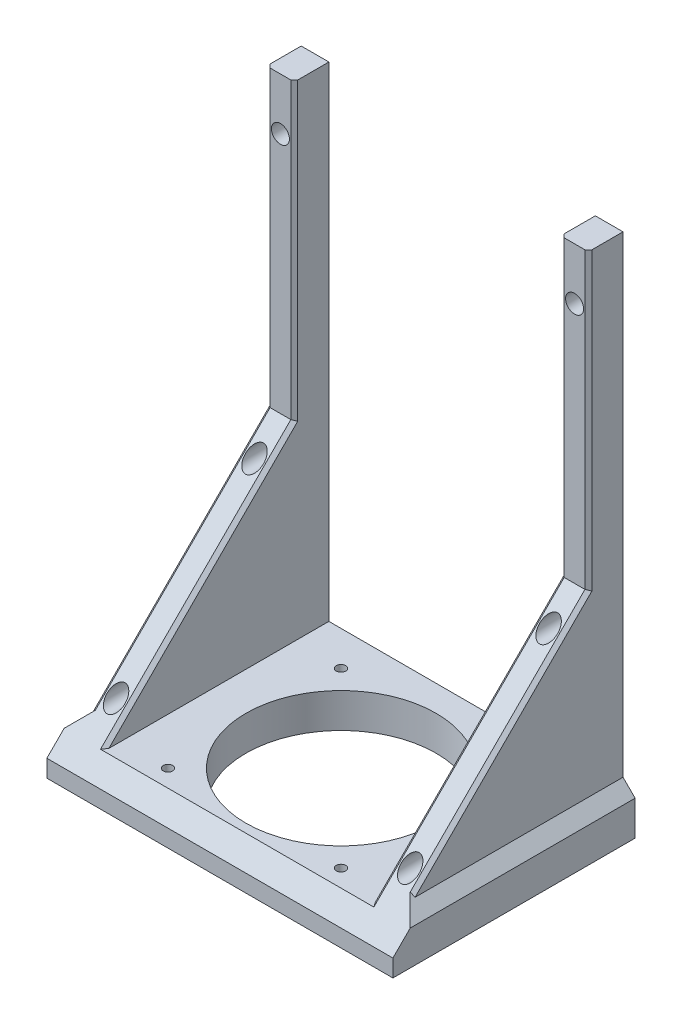
from build123d import *

# Parameters (mm, degrees)
SKETCH1_W           = 100
SKETCH1_H           = 70
SKETCH1_R           = 1.375
SKETCH1_R_2         = 27.5
BOSS_EXTRUDE1_DEPTH = 10
SKETCH3_W           = 8
SKETCH3_H           = 70
BOSS_EXTRUDE2_DEPTH = 55
CHAMFER1_SIZE       = 60
CHAMFER2_SIZE       = 3.5
SKETCH5_W           = 8
SKETCH5_H           = 10
BOSS_EXTRUDE3_DEPTH = 85
CUT_EXTRUDE1_START  = -3.5
SKETCH4_R           = 2.6
CUT_EXTRUDE1_DEPTH  = 169.016070813
SKETCH4_3_R         = 1.375
CUT_EXTRUDE2_DEPTH  = 172.516070813
CHAMFER3_SIZE       = 1


with BuildPart() as part:
    # Sketch1 → Boss-Extrude1 (new body)
    with BuildSketch(Plane(origin=(0, 0, 0), x_dir=(1, 0, 0), z_dir=(0, 1, 0))):
        with Locations((-20.126760563, 24.401408451)):
            Rectangle(SKETCH1_W, SKETCH1_H)
        with Locations(Location((-45.126760563, 49.401408451, 0), (0, 0, 270))):
            Circle(SKETCH1_R, mode=Mode.SUBTRACT)
        with Locations(Location((4.873239437, 49.401408451, 0), (0, 0, 270))):
            Circle(SKETCH1_R, mode=Mode.SUBTRACT)
        with Locations(Location((4.873239437, -0.598591549, 0), (0, 0, 270))):
            Circle(SKETCH1_R, mode=Mode.SUBTRACT)
        with Locations(Location((-45.126760563, -0.598591549, 0), (0, 0, 270))):
            Circle(SKETCH1_R, mode=Mode.SUBTRACT)
        with Locations(Location((-20.126760563, 24.401408451, 0), (0, 0, 270))):
            Circle(SKETCH1_R_2, mode=Mode.SUBTRACT)
    extrude(amount=-BOSS_EXTRUDE1_DEPTH)

    # Sketch3 → Boss-Extrude2 (add)
    with BuildSketch(Plane(origin=(0, 0, 0), x_dir=(1, 0, 0), z_dir=(0, 1, 0))):
        with Locations((-62.626760563, 24.401408451)):
            Rectangle(SKETCH3_W, SKETCH3_H)
        with Locations((22.373239437, 24.401408451)):
            Rectangle(SKETCH3_W, SKETCH3_H)
    extrude(amount=BOSS_EXTRUDE2_DEPTH)

    # Chamfer1
    chamfer1_edges = [part.edges().sort_by_distance(p)[0] for p in [
        (-62.626760563, 55, 10.598591549),
    ]]
    chamfer(chamfer1_edges, length=CHAMFER1_SIZE)

    # Chamfer2
    chamfer2_edges = [part.edges().sort_by_distance(p)[0] for p in [
        (26.373239437, 0, -26.901408451),
        (-66.626760563, 0, -26.901408451),
    ]]
    chamfer(chamfer2_edges, length=CHAMFER2_SIZE - 0.0001)  # a hair under: the kernel refuses the full size

    # Sketch5 → Boss-Extrude3 (add)
    with BuildSketch(Plane(origin=(0, 55, 0), x_dir=(1, 0, 0), z_dir=(0, 1, 0))):
        with Locations((-62.626760563, 54.401408451)):
            Rectangle(SKETCH5_W, SKETCH5_H)
        with Locations((22.373239437, 54.401408451)):
            Rectangle(SKETCH5_W, SKETCH5_H)
    extrude(amount=BOSS_EXTRUDE3_DEPTH)

    # Sketch4 → Cut-Extrude1 (cut, through all)
    with BuildSketch(Plane(origin=(0, 0, -59.401408451), x_dir=(-1, 0, 0), z_dir=(0, 0, -1)).offset(CUT_EXTRUDE1_START)):
        with Locations((-22.373239437, 47.5)):
            Circle(SKETCH4_R)
        with Locations((62.626760563, 47.5)):
            Circle(SKETCH4_R)
        with Locations((62.626760563, 7.5)):
            Circle(SKETCH4_R)
        with Locations((-22.373239437, 7.5)):
            Circle(SKETCH4_R)
        with Locations((-22.373239437, 125)):
            Circle(SKETCH4_R)
        with Locations((62.626760563, 125)):
            Circle(SKETCH4_R)
    extrude(amount=-CUT_EXTRUDE1_DEPTH, mode=Mode.SUBTRACT)

    # Sketch4<3> → Cut-Extrude2 (cut, through all)
    with BuildSketch(Plane(origin=(0, 0, -59.401408451), x_dir=(-1, 0, 0), z_dir=(0, 0, -1))):
        with Locations((-22.373239437, 47.5)):
            Circle(SKETCH4_3_R)
        with Locations((-22.373239437, 7.5)):
            Circle(SKETCH4_3_R)
        with Locations((62.626760563, 47.5)):
            Circle(SKETCH4_3_R)
        with Locations((62.626760563, 7.5)):
            Circle(SKETCH4_3_R)
        with Locations((-22.373239437, 125)):
            Circle(SKETCH4_3_R)
        with Locations((62.626760563, 125)):
            Circle(SKETCH4_3_R)
    extrude(amount=-CUT_EXTRUDE2_DEPTH, mode=Mode.SUBTRACT)

    # Chamfer3
    chamfer3_edges = [part.edges().sort_by_distance(p)[0] for p in [
        (-66.626760563, 29.24995, -23.651358451),
        (-66.626760563, 97.5, -49.401408451),
        (-58.626760563, 97.5, -49.401408451),
        (26.373239437, 97.5, -49.401408451),
        (18.373239437, 97.5, -49.401408451),
        (26.373239437, 29.24995, -23.651358451),
        (18.373239437, 27.5, -21.901408451),
        (-58.626760563, 27.5, -21.901408451),
    ]]
    chamfer(chamfer3_edges, length=CHAMFER3_SIZE)


solid = part.part
